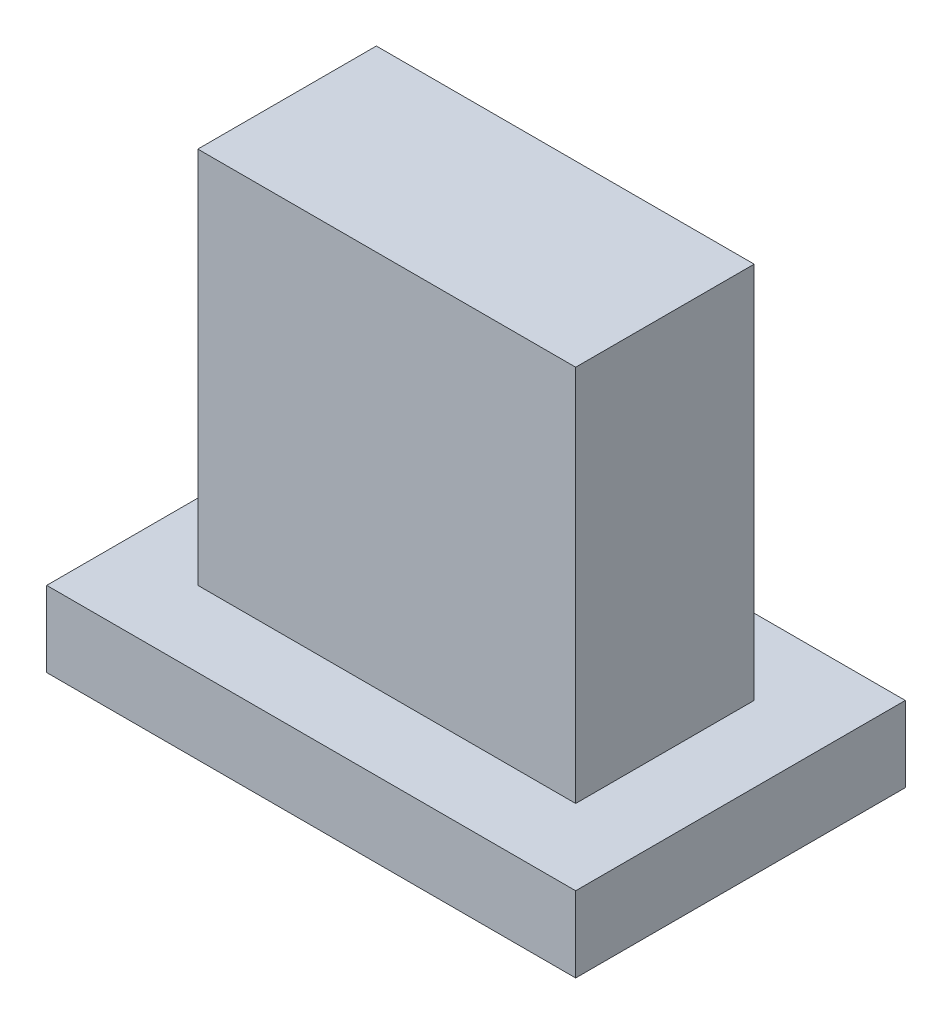
from build123d import *

# Parameters (mm, degrees)
SKETCH1_W           = 12.7
SKETCH1_H           = 6
BOSS_EXTRUDE1_DEPTH = 12.7
SKETCH1_3_W         = 17.78
SKETCH1_3_H         = 11.08
BOSS_EXTRUDE2_DEPTH = 2.54


with BuildPart() as part:
    # Sketch1 → Boss-Extrude1 (new body)
    with BuildSketch(Plane(origin=(0, 0, 0), x_dir=(1, 0, 0), z_dir=(0, 1, 0))):
        Rectangle(SKETCH1_W, SKETCH1_H)
    extrude(amount=BOSS_EXTRUDE1_DEPTH)

    # Sketch1<3> → Boss-Extrude2 (add)
    with BuildSketch(Plane(origin=(0, 0, 0), x_dir=(1, 0, 0), z_dir=(0, 1, 0))):
        Rectangle(SKETCH1_3_W, SKETCH1_3_H)
    extrude(amount=-BOSS_EXTRUDE2_DEPTH)


solid = part.part
